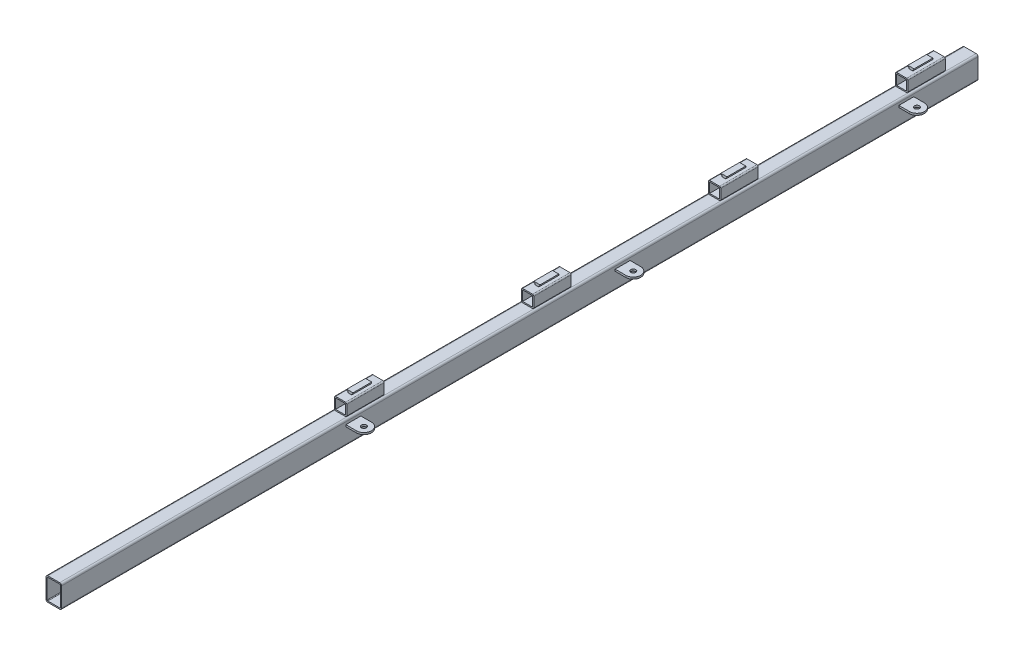
from build123d import *

# Parameters (mm, degrees)
EXTRUDE_THIN1_DEPTH = 1470
SKETCH2_R           = 4
BOSS_EXTRUDE1_DEPTH = 3
SKETCH3_W           = 16
SKETCH3_H           = 16
EXTRUDE_THIN2_DEPTH = 60
BOSS_EXTRUDE2_DEPTH = 15
LPATTERN1_COUNT     = 4
LPATTERN1_PITCH     = 300


with BuildPart() as part:
    # Sketch1 → Extrude-Thin1 (new body)
    with BuildSketch(Plane.XY):
        with BuildLine():
            Line((-9.5, 37), (9.5, 37))
            ThreePointArc((9.5, 37), (11.621320344, 36.121320344), (12.5, 34))
            Line((12.5, 34), (12.5, 3))
            ThreePointArc((12.5, 3), (11.621320344, 0.878679656), (9.5, 0))
            Line((9.5, 0), (-9.5, 0))
            ThreePointArc((-9.5, 0), (-11.621320344, 0.878679656), (-12.5, 3))
            Line((-12.5, 3), (-12.5, 34))
            ThreePointArc((-12.5, 34), (-11.621320344, 36.121320344), (-9.5, 37))
        make_face()
        with BuildLine():
            Line((-9.5, 35), (9.5, 35))
            ThreePointArc((9.5, 35), (10.207106781, 34.707106781), (10.5, 34))
            Line((10.5, 34), (10.5, 3))
            ThreePointArc((10.5, 3), (10.207106781, 2.292893219), (9.5, 2))
            Line((9.5, 2), (-9.5, 2))
            ThreePointArc((-9.5, 2), (-10.207106781, 2.292893219), (-10.5, 3))
            Line((-10.5, 3), (-10.5, 34))
            ThreePointArc((-10.5, 34), (-10.207106781, 34.707106781), (-9.5, 35))
        make_face(mode=Mode.SUBTRACT)
    extrude(amount=EXTRUDE_THIN1_DEPTH)

    # Sketch2 → Boss-Extrude1 (add)
    # profile 1 of 3: a face of its own
    with BuildSketch(Plane(origin=(0, 27, 0), x_dir=(1, 0, 0), z_dir=(0, 1, 0))):
        with BuildLine():
            Line((29.5, -103), (12.5, -103))
            Line((12.5, -103), (12.5, -127))
            Line((12.5, -127), (29.5, -127))
            ThreePointArc((29.5, -127), (41.5, -115), (29.5, -103))
        make_face()
        with Locations((29.5, -115)):
            Circle(SKETCH2_R, mode=Mode.SUBTRACT)
    # profile 2 of 3: a face of its own
    with BuildSketch(Plane(origin=(0, 27, 0), x_dir=(1, 0, 0), z_dir=(0, 1, 0))):
        with BuildLine():
            Line((29.5, -558), (12.5, -558))
            Line((12.5, -558), (12.5, -582))
            Line((12.5, -582), (29.5, -582))
            ThreePointArc((29.5, -582), (41.5, -570), (29.5, -558))
        make_face()
        with Locations((29.5, -570)):
            Circle(SKETCH2_R, mode=Mode.SUBTRACT)
    # profile 3 of 3: a face of its own
    with BuildSketch(Plane(origin=(0, 27, 0), x_dir=(1, 0, 0), z_dir=(0, 1, 0))):
        with BuildLine():
            Line((29.5, -990), (12.5, -990))
            Line((12.5, -990), (12.5, -1014))
            Line((12.5, -1014), (29.5, -1014))
            ThreePointArc((29.5, -1014), (41.5, -1002), (29.5, -990))
        make_face()
        with Locations((29.5, -1002)):
            Circle(SKETCH2_R, mode=Mode.SUBTRACT)
    extrude(amount=BOSS_EXTRUDE1_DEPTH)

    # Sketch3 → Extrude-Thin2 (add)
    with BuildSketch(Plane(origin=(0, 0, 50), x_dir=(-1, 0, 0), z_dir=(0, 0, -1))):
        with BuildLine():
            Line((10, 55), (10, 39))
            ThreePointArc((10, 39), (9.414213562, 37.585786438), (8, 37))
            Line((8, 37), (-8, 37))
            ThreePointArc((-8, 37), (-9.414213562, 37.585786438), (-10, 39))
            Line((-10, 39), (-10, 55))
            ThreePointArc((-10, 55), (-9.414213562, 56.414213562), (-8, 57))
            Line((-8, 57), (8, 57))
            ThreePointArc((8, 57), (9.414213562, 56.414213562), (10, 55))
        make_face()
        with Locations((0, 47)):
            Rectangle(SKETCH3_W, SKETCH3_H, mode=Mode.SUBTRACT)
    extrude_thin2 = extrude(amount=-EXTRUDE_THIN2_DEPTH)

    # Sketch4 → Boss-Extrude2 (add, symmetric)
    with BuildSketch(Plane.XY.offset(80)):
        Polygon((-3, 57), (-3, 59), (-5, 59), (-5, 61), (5, 61), (5, 59), (3, 59), (3, 57), align=None)
    boss_extrude2 = extrude(amount=BOSS_EXTRUDE2_DEPTH, both=True)

    # LPattern1: Extrude-Thin2, Boss-Extrude2 ×4
    with Locations(*[(0, 0, i * LPATTERN1_PITCH) for i in range(1, LPATTERN1_COUNT)]):
        add(extrude_thin2)
        add(boss_extrude2)


solid = part.part
